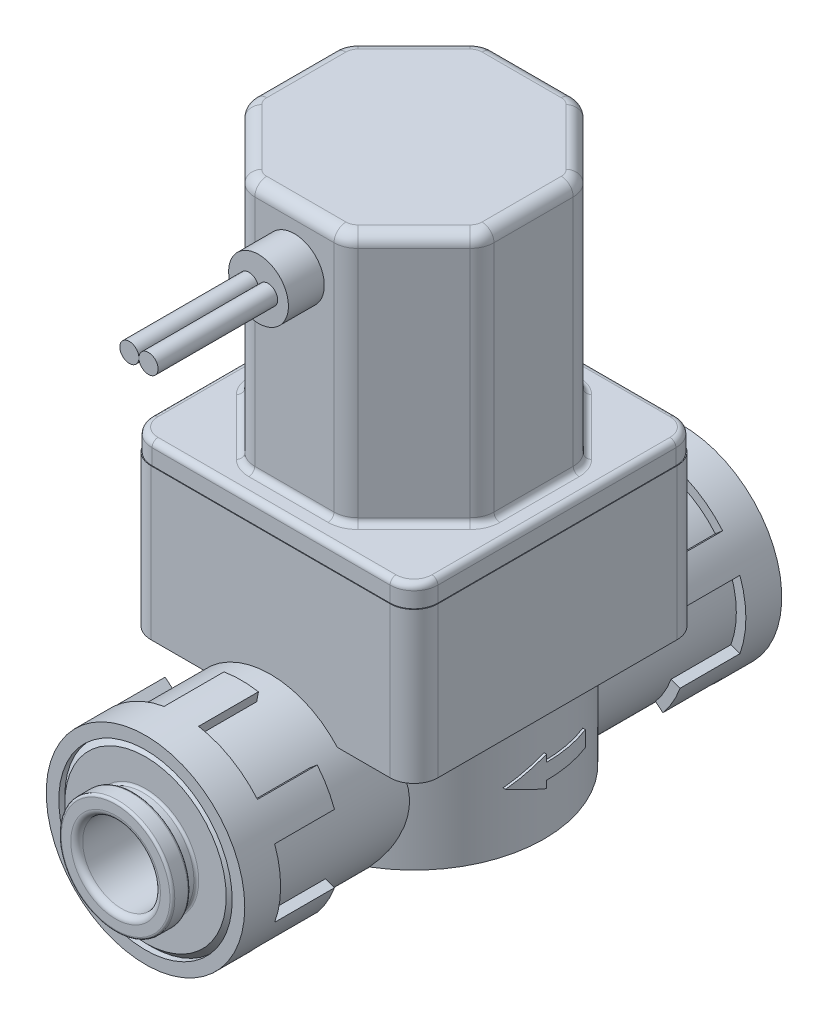
from build123d import *
from build123d.topology import SkipClean

# Parameters (mm, degrees)
ESQUISSE3_R                  = 8.3
ESQUISSE3_R_2                = 7.25
BOSS_EXTRU_1_DEPTH           = 3
BOSS_EXTRU_2_DEPTH           = 5
R_P_TITION_CIRCULAIRE5_COUNT = 2
BOSS_EXTRU_3_REACH           = 47.925
ESQUISSE5_R                  = 7.5
ESQUISSE5_R_2                = 7.25
BOSS_EXTRU_4_DEPTH           = 5
BOSS_EXTRU_4_DEPTH_BACK      = 5
ESQUISSE7_R                  = 10.875
BOSS_EXTRU_5_DEPTH           = 12.6
BOSS_EXTRU_8_DEPTH           = 11.5
BOSS_EXTRU_8_DEPTH_BACK      = 11.5
ENL_V_MAT_EXTRU_1_REACH      = 37.739
BOSS_EXTRU_6_DEPTH           = 1.8
BOSS_EXTRU_7_DEPTH           = 21
CONG_2_R                     = 0.5
CONG_3_R                     = 1
ESQUISSE13_R                 = 2.5
BOSS_EXTRU_9_DEPTH           = 3
ESQUISSE14_R                 = 0.8
BOSS_EXTRU_11_DEPTH          = 10
BOSS_EXTRU_11_2_DEPTH        = 10


with BuildPart() as part:
    # Esquisse1 → Révolution1 (revolve)
    with BuildSketch(Plane(origin=(0, 0, 0), x_dir=(0, 0, -1), z_dir=(1, 0, 0))):
        with BuildLine():
            Line((-24.45, 3.25), (-10.45, 3.25))
            Line((-10.45, 3.25), (-10.45, 4.7625))
            Line((-10.45, 4.7625), (-10.75, 4.7625))
            ThreePointArc((-10.75, 4.7625), (-10.891421356, 4.821078644), (-10.95, 4.9625))
            Line((-10.95, 4.9625), (-10.95, 5.7))
            Line((-10.95, 5.7), (-11.95, 6.7))
            Line((-11.95, 6.7), (-11.957670271, 6.7))
            Line((-11.957670271, 6.7), (-12.95, 6.7))
            Line((-12.95, 6.7), (-12.95, 6.75))
            Line((-12.95, 6.75), (-13.45, 7.25))
            Line((-13.45, 7.25), (-21.95, 7.25))
            Line((-21.95, 7.25), (-22.45, 6.75))
            Line((-22.45, 6.75), (-22.45, 4.45))
            ThreePointArc((-22.45, 4.45), (-22.508578644, 4.308578644), (-22.65, 4.25))
            Line((-22.65, 4.25), (-23.25, 4.25))
            ThreePointArc((-23.25, 4.25), (-23.391421356, 4.308578644), (-23.45, 4.45))
            Line((-23.45, 4.45), (-23.45, 4.55))
            ThreePointArc((-23.45, 4.55), (-23.508578644, 4.691421356), (-23.65, 4.75))
            Line((-23.65, 4.75), (-24.75, 4.75))
            ThreePointArc((-24.75, 4.75), (-24.891421356, 4.691421356), (-24.95, 4.55))
            Line((-24.95, 4.55), (-24.95, 3.75))
            ThreePointArc((-24.95, 3.75), (-24.803553391, 3.396446609), (-24.45, 3.25))
        make_face()
    revolve(axis=Axis((0, 0, 5.995184688), (0, 0, -1)))

    # Esquisse3 → Boss.-Extru.1 (add)
    with BuildSketch(Plane.XY.offset(22.45)):
        Circle(ESQUISSE3_R)
        Circle(ESQUISSE3_R_2, mode=Mode.SUBTRACT)
    extrude(amount=-BOSS_EXTRU_1_DEPTH)

    # Esquisse4 → Boss.-Extru.2 (add)
    with SkipClean():  # the faces are left unmerged after this step: merging them gives an invalid solid
        with BuildSketch(Plane(origin=(0, 0, 19.45), x_dir=(-1, 0, 0), z_dir=(0, 0, -1))):
            with BuildLine():
                Line((-1.441279875, 8.17390435), (-1.258949288, 7.139856209))
                ThreePointArc((-1.258949288, 7.139856209), (0, 7.25), (1.258949288, 7.139856209))
                Line((1.258949288, 7.139856209), (1.441279875, 8.17390435))
                ThreePointArc((1.441279875, 8.17390435), (0, 8.3), (-1.441279875, 8.17390435))
            make_face()
            with BuildLine():
                Line((7.799448753, 2.83876719), (6.812771501, 2.479646039))
                ThreePointArc((6.812771501, 2.479646039), (6.278684177, 3.625), (5.553822213, 4.66021017))
                Line((5.553822213, 4.66021017), (6.358168878, 5.33513716))
                ThreePointArc((6.358168878, 5.33513716), (7.188010851, 4.15), (7.799448753, 2.83876719))
            make_face()
            with BuildLine():
                Line((6.358168878, -5.33513716), (5.553822213, -4.66021017))
                ThreePointArc((5.553822213, -4.66021017), (6.278684177, -3.625), (6.812771501, -2.479646039))
                Line((6.812771501, -2.479646039), (7.799448753, -2.83876719))
                ThreePointArc((7.799448753, -2.83876719), (7.188010851, -4.15), (6.358168878, -5.33513716))
            make_face()
            with BuildLine():
                Line((-1.441279875, -8.17390435), (-1.258949288, -7.139856209))
                ThreePointArc((-1.258949288, -7.139856209), (0, -7.25), (1.258949288, -7.139856209))
                Line((1.258949288, -7.139856209), (1.441279875, -8.17390435))
                ThreePointArc((1.441279875, -8.17390435), (0, -8.3), (-1.441279875, -8.17390435))
            make_face()
            with BuildLine():
                Line((-7.799448753, -2.83876719), (-6.812771501, -2.479646039))
                ThreePointArc((-6.812771501, -2.479646039), (-6.278684177, -3.625), (-5.553822213, -4.66021017))
                Line((-5.553822213, -4.66021017), (-6.358168878, -5.33513716))
                ThreePointArc((-6.358168878, -5.33513716), (-7.188010851, -4.15), (-7.799448753, -2.83876719))
            make_face()
            with BuildLine():
                Line((-6.358168878, 5.33513716), (-5.553822213, 4.66021017))
                ThreePointArc((-5.553822213, 4.66021017), (-6.278684177, 3.625), (-6.812771501, 2.479646039))
                Line((-6.812771501, 2.479646039), (-7.799448753, 2.83876719))
                ThreePointArc((-7.799448753, 2.83876719), (-7.188010851, 4.15), (-6.358168878, 5.33513716))
            make_face()
        extrude(amount=BOSS_EXTRU_2_DEPTH)


with BuildPart() as r_p_tition_circulaire5_1:
    # Répétition circulaire5: pattern copy
    add(part.part.rotate(Axis((0, 12.684799356, 0), (0, -1, 0)), 1 * 360 / R_P_TITION_CIRCULAIRE5_COUNT))

    # Esquisse5 → Boss.-Extru.3 (add, up to next)
    with BuildSketch(Plane(origin=(0, 0, 19.45), x_dir=(-1, 0, 0), z_dir=(0, 0, -1)), mode=Mode.PRIVATE) as boss_extru_3_sk1:
        Circle(ESQUISSE5_R)
        Circle(ESQUISSE5_R_2, mode=Mode.SUBTRACT)
    boss_extru_3_tool1 = extrude(boss_extru_3_sk1.sketch, amount=BOSS_EXTRU_3_REACH, mode=Mode.PRIVATE) - r_p_tition_circulaire5_1.part

    add(part.part)  # Boss.-Extru.3 merges part
    add(boss_extru_3_tool1.solids().sort_by_distance((7.287868, 0, 19.45))[0])

    # Esquisse7 → Boss.-Extru.4 (add, two sides: drawn at the far end of the back side and taken through both)
    with BuildSketch(Plane(origin=(0, 0, 0), x_dir=(1, 0, 0), z_dir=(0, 1, 0)).offset(-BOSS_EXTRU_4_DEPTH_BACK)):
        Circle(ESQUISSE7_R)
    extrude(amount=BOSS_EXTRU_4_DEPTH + BOSS_EXTRU_4_DEPTH_BACK)

    # Esquisse8 → Boss.-Extru.5 (add)
    with BuildSketch(Plane(origin=(0, 5, 0), x_dir=(1, 0, 0), z_dir=(0, 1, 0))):
        with BuildLine():
            Line((-10, 12), (10, 12))
            ThreePointArc((10, 12), (11.414213562, 11.414213562), (12, 10))
            Line((12, 10), (12, -10))
            ThreePointArc((12, -10), (11.414213562, -11.414213562), (10, -12))
            Line((10, -12), (-10, -12))
            ThreePointArc((-10, -12), (-11.414213562, -11.414213562), (-12, -10))
            Line((-12, -10), (-12, 10))
            ThreePointArc((-12, 10), (-11.414213562, 11.414213562), (-10, 12))
        make_face()
    extrude(amount=BOSS_EXTRU_5_DEPTH)

    # Esquisse11 → Boss.-Extru.8 (add, two sides: drawn at the far end of the back side and taken through both)
    with BuildSketch(Plane(origin=(0, 0, 0), x_dir=(0, 0, -1), z_dir=(1, 0, 0)).offset(-BOSS_EXTRU_8_DEPTH_BACK)):
        Polygon((0, -1.25), (-3, 0), (0, 1.25), (0, 0.65), (4, 0.65), (4, -0.65), (0, -0.65), align=None)
    extrude(amount=BOSS_EXTRU_8_DEPTH + BOSS_EXTRU_8_DEPTH_BACK)

    # Esquisse12 → Enlèv. mat.-Extru.1 (cut, up to next)
    with BuildSketch(Plane.XZ.offset(5), mode=Mode.PRIVATE) as enl_v_mat_extru_1_sk1:
        with BuildLine():
            Line((-11.54923721, 5.967840469), (-9.797646051, 5.163502382))
            ThreePointArc((-9.797646051, 5.163502382), (-11.054901476, -0.666917046), (-9.10584335, -6.303906874))
            Line((-9.10584335, -6.303906874), (-10.729850627, -7.339639332))
            ThreePointArc((-10.729850627, -7.339639332), (-12.97542652, -0.798940938), (-11.54923721, 5.967840469))
        make_face()
    enl_v_mat_extru_1_tool1 = extrude(enl_v_mat_extru_1_sk1.sketch, amount=-ENL_V_MAT_EXTRU_1_REACH, mode=Mode.PRIVATE) & r_p_tition_circulaire5_1.part
    # Esquisse12 → Enlèv. mat.-Extru.1 (cut, up to next)
    with BuildSketch(Plane.XZ.offset(5), mode=Mode.PRIVATE) as enl_v_mat_extru_1_sk2:
        with BuildLine():
            Line((9.10584335, 6.303906874), (10.729850627, 7.339639332))
            ThreePointArc((10.729850627, 7.339639332), (12.97542652, 0.798940938), (11.54923721, -5.967840469))
            Line((11.54923721, -5.967840469), (9.797646051, -5.163502382))
            ThreePointArc((9.797646051, -5.163502382), (11.054901476, 0.666917046), (9.10584335, 6.303906874))
        make_face()
    enl_v_mat_extru_1_tool2 = extrude(enl_v_mat_extru_1_sk2.sketch, amount=-ENL_V_MAT_EXTRU_1_REACH, mode=Mode.PRIVATE) & r_p_tition_circulaire5_1.part
    add(enl_v_mat_extru_1_tool1.solids().sort_by_distance((-11.458967, -5, -0.699177))[0], mode=Mode.SUBTRACT)
    add(enl_v_mat_extru_1_tool2.solids().sort_by_distance((11.458967, -5, 0.699177))[0], mode=Mode.SUBTRACT)

    # Esquisse9 → Boss.-Extru.6 (add)
    with BuildSketch(Plane(origin=(0, 17.6, 0), x_dir=(1, 0, 0), z_dir=(0, 1, 0))):
        with BuildLine():
            Line((-9.95, -11.95), (9.95, -11.95))
            ThreePointArc((9.95, -11.95), (11.364213562, -11.364213562), (11.95, -9.95))
            Line((11.95, -9.95), (11.95, 9.95))
            ThreePointArc((11.95, 9.95), (11.364213562, 11.364213562), (9.95, 11.95))
            Line((9.95, 11.95), (-9.95, 11.95))
            ThreePointArc((-9.95, 11.95), (-11.364213562, 11.364213562), (-11.95, 9.95))
            Line((-11.95, 9.95), (-11.95, -9.95))
            ThreePointArc((-11.95, -9.95), (-11.364213562, -11.364213562), (-9.95, -11.95))
        make_face()
    extrude(amount=BOSS_EXTRU_6_DEPTH)

    # Esquisse10 → Boss.-Extru.7 (add)
    with BuildSketch(Plane(origin=(0, 19.4, 0), x_dir=(1, 0, 0), z_dir=(0, 1, 0))):
        with BuildLine():
            Line((-3.313708499, -10), (3.313708499, -10))
            ThreePointArc((3.313708499, -10), (4.079075364, -9.847759065), (4.727922061, -9.414213562))
            Line((4.727922061, -9.414213562), (9.414213562, -4.727922061))
            ThreePointArc((9.414213562, -4.727922061), (9.847759065, -4.079075364), (10, -3.313708499))
            Line((10, -3.313708499), (10, 3.313708499))
            ThreePointArc((10, 3.313708499), (9.847759065, 4.079075364), (9.414213562, 4.727922061))
            Line((9.414213562, 4.727922061), (4.727922061, 9.414213562))
            ThreePointArc((4.727922061, 9.414213562), (4.079075364, 9.847759065), (3.313708499, 10))
            Line((3.313708499, 10), (-3.313708499, 10))
            ThreePointArc((-3.313708499, 10), (-4.079075364, 9.847759065), (-4.727922061, 9.414213562))
            Line((-4.727922061, 9.414213562), (-9.414213562, 4.727922061))
            ThreePointArc((-9.414213562, 4.727922061), (-9.847759065, 4.079075364), (-10, 3.313708499))
            Line((-10, 3.313708499), (-10, -3.313708499))
            ThreePointArc((-10, -3.313708499), (-9.847759065, -4.079075364), (-9.414213562, -4.727922061))
            Line((-9.414213562, -4.727922061), (-4.727922061, -9.414213562))
            ThreePointArc((-4.727922061, -9.414213562), (-4.079075364, -9.847759065), (-3.313708499, -10))
        make_face()
    extrude(amount=BOSS_EXTRU_7_DEPTH)

    # Congé2
    cong_2_edges = [r_p_tition_circulaire5_1.edges().sort_by_distance(p)[0] for p in [
        (-11.364213562, 19.4, -11.364213562),
        (0, 19.4, -11.95),
        (11.364213562, 19.4, -11.364213562),
        (11.95, 19.4, 0),
        (11.364213562, 19.4, 11.364213562),
        (0, 19.4, 11.95),
        (-11.364213562, 19.4, 11.364213562),
        (-4.079075364, 19.4, -9.847759065),
        (0, 19.4, -10),
        (4.079075364, 19.4, -9.847759065),
        (7.071067812, 19.4, -7.071067812),
        (9.847759065, 19.4, -4.079075364),
        (10, 19.4, 0),
        (9.847759065, 19.4, 4.079075364),
        (7.071067812, 19.4, 7.071067812),
        (4.079075364, 19.4, 9.847759065),
        (0, 19.4, 10),
        (-4.079075364, 19.4, 9.847759065),
        (-7.071067812, 19.4, 7.071067812),
        (-9.847759065, 19.4, 4.079075364),
        (-10, 19.4, 0),
        (-9.847759065, 19.4, -4.079075364),
        (-11.95, 19.4, 0),
        (-7.071067812, 19.4, -7.071067812),
    ]]
    fillet(cong_2_edges, radius=CONG_2_R)

    # Congé3
    cong_3_edges = [r_p_tition_circulaire5_1.edges().sort_by_distance(p)[0] for p in [
        (-4.079075364, 40.4, -9.847759065),
        (0, 40.4, -10),
        (4.079075364, 40.4, -9.847759065),
        (7.071067812, 40.4, -7.071067812),
        (9.847759065, 40.4, -4.079075364),
        (10, 40.4, 0),
        (9.847759065, 40.4, 4.079075364),
        (7.071067812, 40.4, 7.071067812),
        (4.079075364, 40.4, 9.847759065),
        (0, 40.4, 10),
        (-4.079075364, 40.4, 9.847759065),
        (-7.071067812, 40.4, 7.071067812),
        (-9.847759065, 40.4, 4.079075364),
        (-10, 40.4, 0),
        (-9.847759065, 40.4, -4.079075364),
        (-7.071067812, 40.4, -7.071067812),
    ]]
    fillet(cong_3_edges, radius=CONG_3_R)

    # Esquisse13 → Boss.-Extru.9 (add)
    with BuildSketch(Plane.XY.offset(10)):
        with Locations((0, 35.9)):
            Circle(ESQUISSE13_R)
    extrude(amount=BOSS_EXTRU_9_DEPTH)


with BuildPart() as body_2:
    # Esquisse14 → Boss.-Extru.11 (new body)
    with BuildSketch(Plane.XY.offset(13)):
        with Locations((-0.8, 35.9)):
            Circle(ESQUISSE14_R)
    extrude(amount=BOSS_EXTRU_11_DEPTH)


with BuildPart() as body_3:
    # Esquisse14 → Boss.-Extru.11 2 (new body)
    with BuildSketch(Plane.XY.offset(13)):
        with Locations((0.8, 35.9)):
            Circle(ESQUISSE14_R)
    extrude(amount=BOSS_EXTRU_11_2_DEPTH)


solid = Compound([r_p_tition_circulaire5_1.part, body_2.part, body_3.part])
